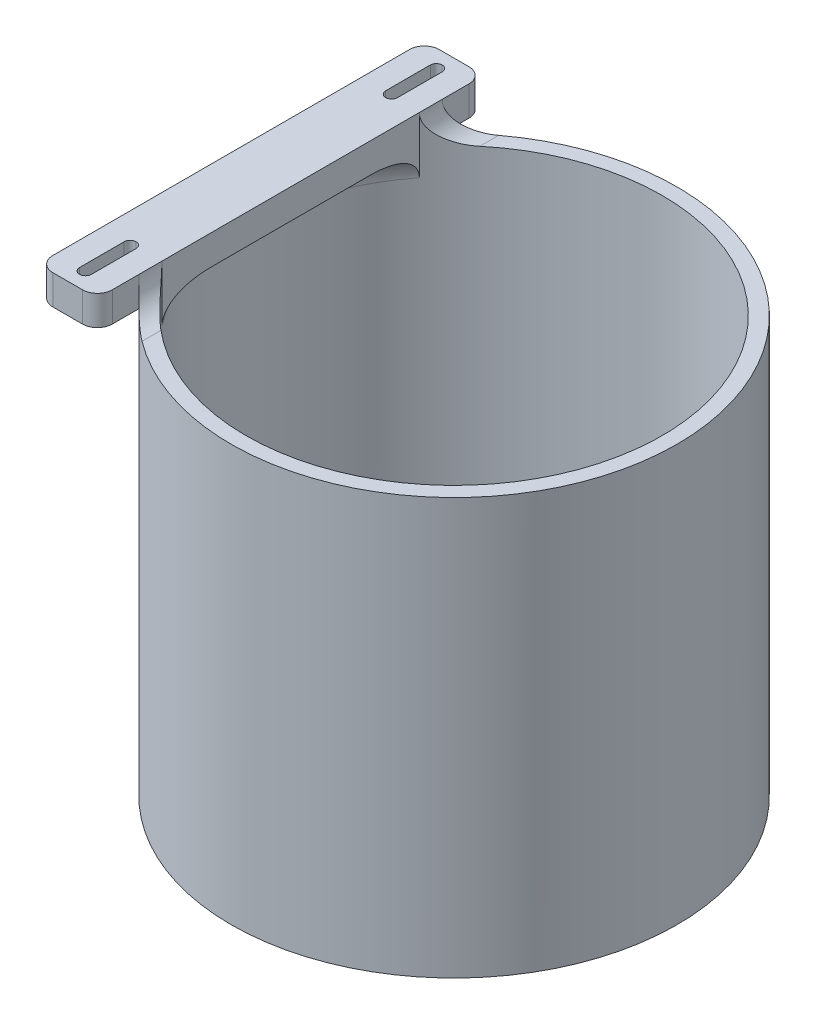
from build123d import *

# Parameters (mm, degrees)
SKETCH1_R            = 75
SKETCH1_R_2          = 70
BOSS_EXTRUDE1_DEPTH  = 140
SKETCH2_W            = 20
SKETCH2_H            = 130
BOSS_EXTRUDE2_DEPTH  = 10
FILLET1_R            = 9
FILLET2_R            = 10
FILLET3_R            = 5
SKETCH5_W            = 4
SKETCH5_H            = 19
CUT_EXTRUDE1_DEPTH   = 10
FILLET4_R            = 2
FILLET4_OF_MIRROR4_R = 2


# Some blends are built 0.0001 mm under size
with BuildPart() as part:
    # Sketch1 → Boss-Extrude1 (new body)
    with BuildSketch(Plane(origin=(0, 0, 0), x_dir=(1, 0, 0), z_dir=(0, 1, 0))):
        with Locations(Location((0, 0, 0), (0, 0, 270))):
            Circle(SKETCH1_R)
        with Locations(Location((0, 0, 0), (0, 0, 270))):
            Circle(SKETCH1_R_2, mode=Mode.SUBTRACT)
    extrude(amount=BOSS_EXTRUDE1_DEPTH)

    # Sketch2 → Boss-Extrude2 (add)
    with BuildSketch(Plane(origin=(0, 140, 0), x_dir=(1, 0, 0), z_dir=(0, 1, 0))):
        with Locations((-65, 0)):
            Rectangle(SKETCH2_W, SKETCH2_H)
    extrude(amount=BOSS_EXTRUDE2_DEPTH)

    # Fillet1
    # the kernel refuses this fillet: 9 mm, written as the material it adds along each edge
    with BuildSketch(Plane(origin=(0, 140, 0), x_dir=(-0.5499699922766536, 0, -0.835184415321082), z_dir=(0.835184415321082, 0, -0.5499699922766536))) as fillet1_piece_1_section:
        with BuildLine():
            CenterArc((70 - FILLET1_R, -FILLET1_R), FILLET1_R, 0, 90)
            Line((70 - FILLET1_R, 0), (70, 0))
            Line((70, 0), (70, -FILLET1_R))
        make_face()
    fillet1_piece_1 = revolve(axis=Axis((0, 140, 0), (0, 1, 0)), revolution_arc=113.270091323, mode=Mode.PRIVATE)
    fillet1_piece_1 = split(fillet1_piece_1, bisect_by=Plane(origin=(-55, 137.444603365, 0), z_dir=(-1, 0, 0)), keep=Keep.TOP, mode=Mode.PRIVATE)
    add(fillet1_piece_1)

    # Fillet2
    # the kernel refuses this fillet: 10 mm, written as the material it adds along each edge
    with BuildSketch(Plane(origin=(-55, 140, -75.990195136), x_dir=(0, 1, 0), z_dir=(0, 0, 1))) as fillet2_piece_1_section:
        with BuildLine():
            CenterArc((FILLET2_R, -FILLET2_R), FILLET2_R, 90, 90)
            Line((0, -FILLET2_R), (0, 0))
            Line((0, 0), (FILLET2_R, 0))
        make_face()
    fillet2_piece_1 = extrude(amount=57.688924947, mode=Mode.PRIVATE)
    fillet2_piece_1 = fillet2_piece_1 - Plane(origin=(0, 142.276585478, 0), x_dir=(0, 0, 1), z_dir=(0, -1, 0)) * Cylinder(70, 156, mode=Mode.PRIVATE)
    fillet2_piece_1 = fillet2_piece_1 & Plane(origin=(0, 142.276585478, 0), x_dir=(0, 0, 1), z_dir=(0, -1, 0)) * Cylinder(75, 156, mode=Mode.PRIVATE)
    add(fillet2_piece_1)
    with BuildSketch(Plane(origin=(-55, 140, 18.301270189), x_dir=(0, 1, 0), z_dir=(0, 0, 1))) as fillet2_piece_2_section:
        with BuildLine():
            CenterArc((FILLET2_R, -FILLET2_R), FILLET2_R, 90, 90)
            Line((0, -FILLET2_R), (0, 0))
            Line((0, 0), (FILLET2_R, 0))
        make_face()
    fillet2_piece_2 = extrude(amount=57.688924947, mode=Mode.PRIVATE)
    fillet2_piece_2 = fillet2_piece_2 - Plane(origin=(0, 142.276601392, 0), x_dir=(0, 0, 1), z_dir=(0, -1, 0)) * Cylinder(70, 156, mode=Mode.PRIVATE)
    fillet2_piece_2 = fillet2_piece_2 & Plane(origin=(0, 142.276601392, 0), x_dir=(0, 0, 1), z_dir=(0, -1, 0)) * Cylinder(75, 156, mode=Mode.PRIVATE)
    add(fillet2_piece_2)

    # Fillet3
    fillet3_edges = [part.edges().sort_by_distance(p)[0] for p in [
        (-75, 145, -65),
        (-75, 145, 65),
        (-55, 145, 65),
        (-55, 145, -65),
    ]]
    fillet(fillet3_edges, radius=FILLET3_R)

    # Sketch5 → Cut-Extrude1 (cut)
    with BuildSketch(Plane(origin=(0, 150, 0), x_dir=(1, 0, 0), z_dir=(0, 1, 0))):
        with Locations((-65, -51.5)):
            Rectangle(SKETCH5_W, SKETCH5_H)
    cut_extrude1 = extrude(amount=-CUT_EXTRUDE1_DEPTH, mode=Mode.SUBTRACT)

    # Fillet4
    fillet4_edges = [part.edges().sort_by_distance(p)[0] for p in [
        (-67, 145, 42),
        (-63, 145, 42),
        (-67, 145, 61),
        (-63, 145, 61),
    ]]
    fillet(fillet4_edges, radius=FILLET4_R - 0.0001)  # a hair under: the kernel refuses the full size

    # Mirror4: Cut-Extrude1 across plane
    add(cut_extrude1.mirror(Plane.XY), mode=Mode.SUBTRACT)

    # Fillet4 of Mirror4
    fillet4_of_mirror4_edges = [part.edges().sort_by_distance(p)[0] for p in [
        (-67, 145, -42),
        (-63, 145, -42),
        (-67, 145, -61),
        (-63, 145, -61),
    ]]
    fillet(fillet4_of_mirror4_edges, radius=FILLET4_OF_MIRROR4_R - 0.0001)  # a hair under: the kernel refuses the full size


solid = part.part
